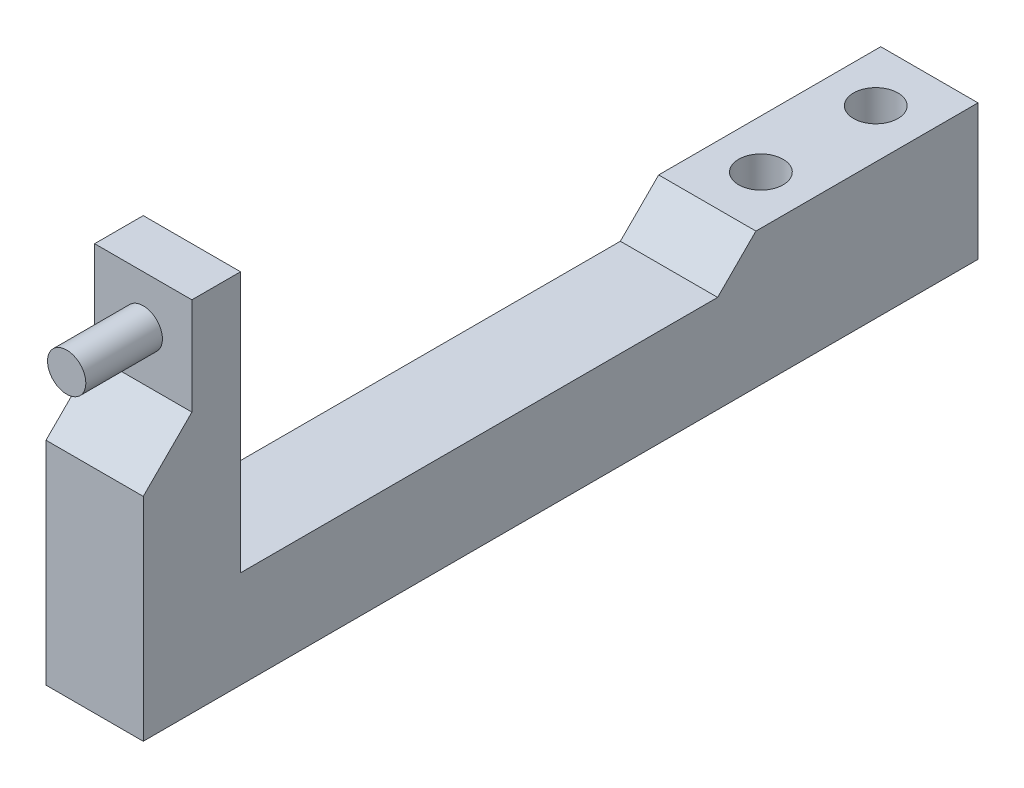
from build123d import *

# Parameters (mm, degrees)
SKETCH2_W                     = 12.7
SKETCH2_H                     = 109
BOSS_EXTRUDE1_DEPTH           = 12.7
SKETCH5_W                     = 12.7
SKETCH5_H                     = 29
BOSS_EXTRUDE2_DEPTH           = 5
CBORE_FOR_M5_SHCS1_AT_2_COUNT = 2
CBORE_FOR_M5_SHCS1_AT_2_PITCH = 15
CHAMFER1_SIZE                 = 5
SKETCH7_W                     = 12.7
SKETCH7_H                     = 12.7
BOSS_EXTRUDE4_DEPTH           = 34.05
SKETCH9_W                     = 12.7
SKETCH9_H                     = 12.7
CUT_EXTRUDE2_DEPTH            = 6.35
SKETCH6_R                     = 2.5
BOSS_EXTRUDE7_DEPTH           = 10
CHAMFER3_SIZE                 = 6.35


with BuildPart() as part:
    # Sketch2 → Boss-Extrude1 (new body)
    with BuildSketch(Plane(origin=(0, 0, 0), x_dir=(1, 0, 0), z_dir=(0, 1, 0))):
        Rectangle(SKETCH2_W, SKETCH2_H)
    extrude(amount=BOSS_EXTRUDE1_DEPTH)

    # Sketch5 → Boss-Extrude2 (add)
    with BuildSketch(Plane(origin=(0, 12.7, 0), x_dir=(1, 0, 0), z_dir=(0, 1, 0))):
        with Locations((0, 40)):
            Rectangle(SKETCH5_W, SKETCH5_H)
    extrude(amount=BOSS_EXTRUDE2_DEPTH)

    # Sketch4 → CBORE for M5 SHCS1 (revolve, cut)
    with BuildSketch(Plane(origin=(0, 0, -47.5), x_dir=(0, 0, -1), z_dir=(1, 0, 0))):
        Polygon((0, 0), (0, 17.7), (2.9, 17.7), (2.9, 5), (5, 5), (5, 0.020977491), (5.025, 0), align=None)
    cbore_for_m5_shcs1 = revolve(axis=Axis((0, -6.35, -47.5), (0, 1, 0)), mode=Mode.SUBTRACT)

    # CBORE for M5 SHCS1 at 2: CBORE for M5 SHCS1 ×2
    with Locations(*[(0, 0, i * CBORE_FOR_M5_SHCS1_AT_2_PITCH) for i in range(1, CBORE_FOR_M5_SHCS1_AT_2_COUNT)]):
        add(cbore_for_m5_shcs1, mode=Mode.SUBTRACT)

    # Chamfer1
    chamfer1_edges = [part.edges().sort_by_distance(p)[0] for p in [
        (0, 12.7, -25.5),
    ]]
    chamfer(chamfer1_edges, length=CHAMFER1_SIZE - 0.0001)  # a hair under: the kernel refuses the full size

    # Sketch7 → Boss-Extrude4 (add)
    with BuildSketch(Plane(origin=(0, 12.7, 0), x_dir=(1, 0, 0), z_dir=(0, 1, 0))):
        with Locations((0, -48.15)):
            Rectangle(SKETCH7_W, SKETCH7_H)
    extrude(amount=BOSS_EXTRUDE4_DEPTH)

    # Sketch9 → Cut-Extrude2 (cut)
    with BuildSketch(Plane.XY.offset(54.5)):
        with Locations((0, 40.4)):
            Rectangle(SKETCH9_W, SKETCH9_H)
    extrude(amount=-CUT_EXTRUDE2_DEPTH, mode=Mode.SUBTRACT)

    # Sketch6 → Boss-Extrude7 (add)
    with BuildSketch(Plane.XY.offset(48.15)):
        with Locations((0, 40.4)):
            Circle(SKETCH6_R)
    extrude(amount=BOSS_EXTRUDE7_DEPTH)

    # Chamfer3
    chamfer3_edges = [part.edges().sort_by_distance(p)[0] for p in [
        (0, 34.05, 54.5),
    ]]
    chamfer(chamfer3_edges, length=CHAMFER3_SIZE - 0.0001)  # a hair under: the kernel refuses the full size


solid = part.part
